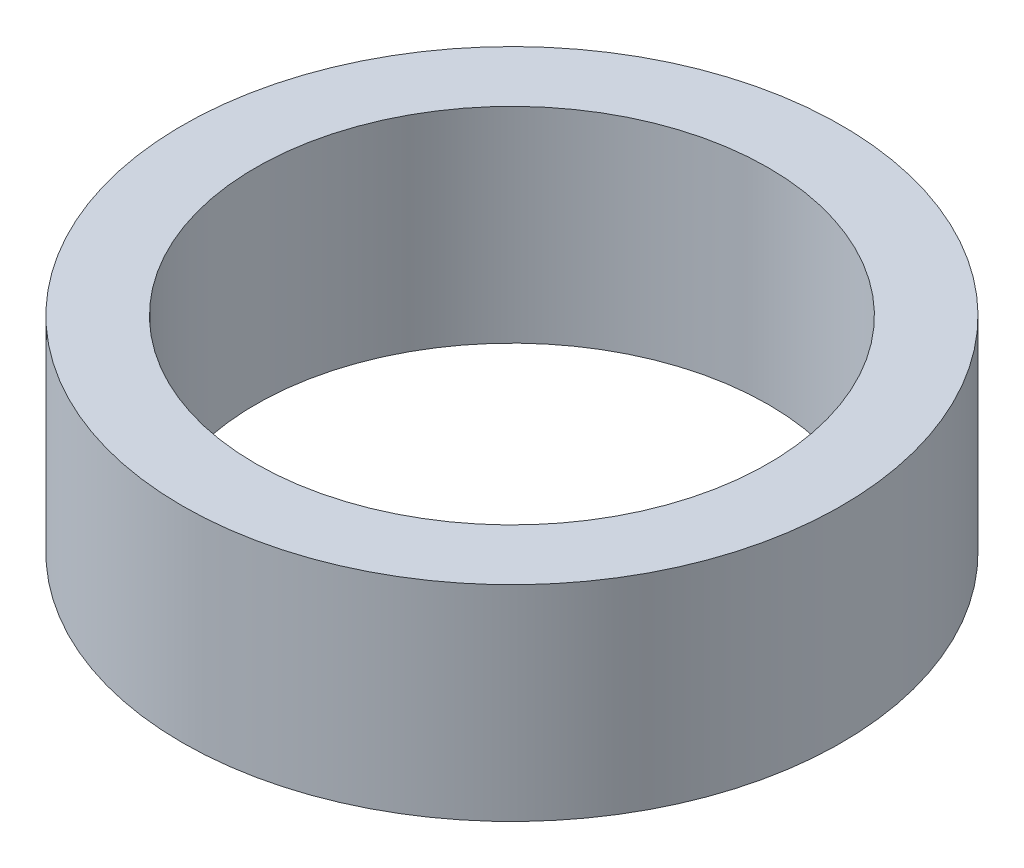
from build123d import *

# Parameters (mm, degrees)
SKETCH1_R           = 45
BOSS_EXTRUDE1_DEPTH = 28
SKETCH2_R           = 35
CUT_EXTRUDE1_DEPTH  = 70.526973183


with BuildPart() as part:
    # Sketch1 → Boss-Extrude1 (new body)
    with BuildSketch(Plane(origin=(0, 0, 0), x_dir=(1, 0, 0), z_dir=(0, 1, 0))):
        Circle(SKETCH1_R)
    extrude(amount=BOSS_EXTRUDE1_DEPTH)

    # Sketch2 → Cut-Extrude1 (cut, through all)
    with BuildSketch(Plane(origin=(0, 0, 0), x_dir=(1, 0, 0), z_dir=(0, 1, 0))):
        Circle(SKETCH2_R)
    extrude(amount=CUT_EXTRUDE1_DEPTH, mode=Mode.SUBTRACT)


solid = part.part
